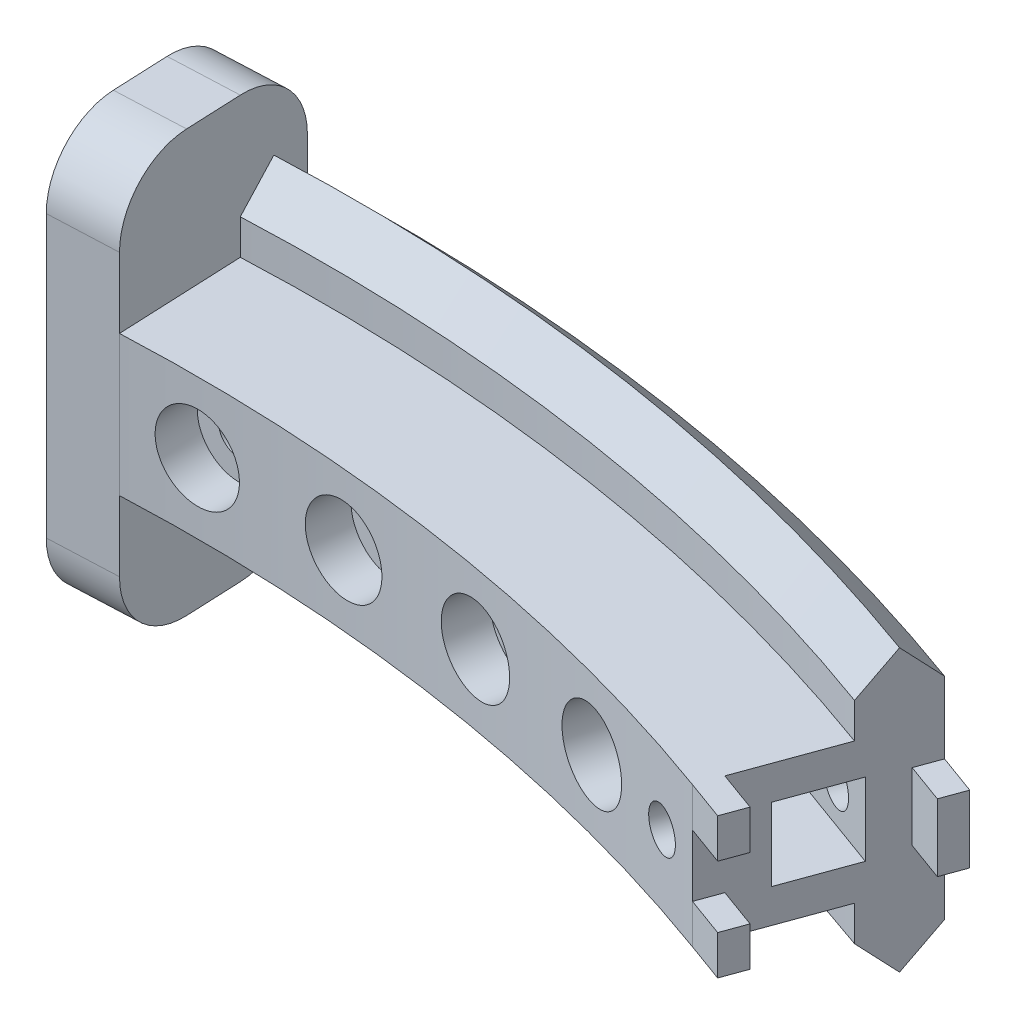
from build123d import *

# Parameters (mm, degrees)
REVOLVE_1_ANGLE          = 40
SKETCH_3_W               = 5.2
SKETCH_3_H               = 5.2
CUT_EXTRUDE_1_DEPTH      = 7
CUT_EXTRUDE_2_DEPTH      = 94.967026614
CUT_EXTRUDE_2_DEPTH_BACK = 94.967026614
SKETCH_5_R               = 1.5
CUT_EXTRUDE_START        = -2
SKETCH_6_R               = 3
CUT_EXTRUDE_3_DEPTH      = 93.938324905
SKETCH_12_R              = 1.5
CUT_EXTRUDE_5_DEPTH      = 54.141615619
CUT_EXTRUDE_6_DEPTH      = 5
SKETCH_14_W              = 3
SKETCH_14_H              = 3
PATTERN_CIRCULAR_1_COUNT = 4
PATTERN_CIRCULAR_1_ANGLE = 15
F_1_THE_OTHER_WAY_COUNT  = 4
F_1_THE_OTHER_WAY_ANGLE  = 15
SKETCH_9_W               = 1.8
SKETCH_9_H               = 4.8
SKETCH_9_H_2             = 2.8
EXTRUDE_2_DEPTH          = 3
SKETCH_10_W              = 52.448370613
SKETCH_10_H              = 39.953744926
CUT_EXTRUDE_4_DEPTH      = 149.179341739
SKETCH_11_W              = 14
SKETCH_11_H              = 30
EXTRUDE_3_DEPTH          = 5
FILLET_1_R               = 5


# Read off the part's stored shape, not the designer's step: 旋转1
with BuildPart() as part:
    # 旋转1 outline → 旋转1 (revolve)
    with BuildSketch(Plane(origin=(0, 0, 0), x_dir=(0.3420201433256701, 0, -0.9396926207859079), z_dir=(0.9396926207859079, 0, 0.3420201433256701))):
        Polygon((134, 5), (125, 5), (125, -5), (134, -5), (134, -7.5), (136.5, -10), (139, -7.5), (139, 7.5), (136.5, 10), (134, 7.5), align=None)
    revolve(axis=Axis((0, 0, 0), (0, 1, 0)), revolution_arc=REVOLVE_1_ANGLE)

    # 草图3 → 切除-拉伸1 (cut)
    with BuildSketch(Plane(origin=(0, 0, 0), x_dir=(0.34202014332566943, 0, -0.9396926207859081), z_dir=(0.9396926207859081, 0, 0.34202014332566943))):
        with Locations((132, 0)):
            Rectangle(SKETCH_3_W, SKETCH_3_H)
    extrude(amount=-CUT_EXTRUDE_1_DEPTH, mode=Mode.SUBTRACT)

    # 草图5 → 切除-拉伸2 (cut, two sides: drawn at the far end of the back side and taken through both)
    with BuildSketch(Plane(origin=(44.257406546, 0, -121.59622513), x_dir=(-0.9396926207859081, 0, -0.3420201433256695), z_dir=(0.3420201433256695, 0, -0.9396926207859081)).offset(-CUT_EXTRUDE_2_DEPTH_BACK)):
        with Locations((3.5, 0)):
            Circle(SKETCH_5_R)
    extrude(amount=CUT_EXTRUDE_2_DEPTH + CUT_EXTRUDE_2_DEPTH_BACK, mode=Mode.SUBTRACT)

    # 草图6 → 切除-拉伸3 (cut, through all)
    with BuildSketch(Plane(origin=(46.035911292, 0, -126.482626758), x_dir=(0.9396926207859081, 0, 0.3420201433256695), z_dir=(-0.3420201433256695, 0, 0.9396926207859081)).offset(CUT_EXTRUDE_START)):
        with Locations((-3.5, 0)):
            Circle(SKETCH_6_R)
    extrude(amount=-CUT_EXTRUDE_3_DEPTH, mode=Mode.SUBTRACT)

    # 草图12 → 切除-拉伸5 (cut, through all)
    with BuildSketch(Plane(origin=(0, 0, -139), x_dir=(-1, 0, 0), z_dir=(0, 0, -1))):
        Circle(SKETCH_12_R)
    cut_extrude_5 = extrude(amount=-CUT_EXTRUDE_5_DEPTH, mode=Mode.SUBTRACT)

    # 草图13 → 切除-拉伸6 (cut)
    with BuildSketch(Plane(origin=(0, 0, -139), x_dir=(-1, 0, 0), z_dir=(0, 0, -1))):
        Polygon((0, -3.175426481), (2.75, -1.58771324), (2.75, 1.58771324), (0, 3.175426481), (-2.75, 1.58771324), (-2.75, -1.58771324), align=None)
    cut_extrude_6 = extrude(amount=-CUT_EXTRUDE_6_DEPTH, mode=Mode.SUBTRACT)

    # 草图14 → 切除-旋转1 (revolve, cut)
    with BuildSketch(Plane(origin=(0, 0, 0), x_dir=(1, 0, 0), z_dir=(0, 1, 0)), mode=Mode.PRIVATE) as cut_revolve_1_sk:
        with Locations((1.5, 126.463994814)):
            Rectangle(SKETCH_14_W, SKETCH_14_H)
    cut_revolve_1 = revolve(cut_revolve_1_sk.sketch.rotate(Axis((0, 0, 1000), (0, 0, -1)), 180), axis=Axis((0, 0, 1000), (0, 0, -1)), mode=Mode.SUBTRACT)

    # 阵列(圆周)1: 切除-拉伸5, 切除-拉伸6, 切除-旋转1 ×4 about axis
    pattern_circular_1_axis = Axis((0, 0, 0), (0, 1, 0))
    add([cut_extrude_5.rotate(pattern_circular_1_axis, i * PATTERN_CIRCULAR_1_ANGLE / (PATTERN_CIRCULAR_1_COUNT - 1)) for i in range(1, PATTERN_CIRCULAR_1_COUNT)], mode=Mode.SUBTRACT)
    add([cut_extrude_6.rotate(pattern_circular_1_axis, i * PATTERN_CIRCULAR_1_ANGLE / (PATTERN_CIRCULAR_1_COUNT - 1)) for i in range(1, PATTERN_CIRCULAR_1_COUNT)], mode=Mode.SUBTRACT)
    add([cut_revolve_1.rotate(pattern_circular_1_axis, i * PATTERN_CIRCULAR_1_ANGLE / (PATTERN_CIRCULAR_1_COUNT - 1)) for i in range(1, PATTERN_CIRCULAR_1_COUNT)], mode=Mode.SUBTRACT)

    # 1 the other way: 切除-拉伸5, 切除-拉伸6, 切除-旋转1 ×4 about axis
    f_1_the_other_way_axis = Axis((0, 0, 0), (0, -1, 0))
    add([cut_extrude_5.rotate(f_1_the_other_way_axis, i * F_1_THE_OTHER_WAY_ANGLE / (F_1_THE_OTHER_WAY_COUNT - 1)) for i in range(1, F_1_THE_OTHER_WAY_COUNT)], mode=Mode.SUBTRACT)
    add([cut_extrude_6.rotate(f_1_the_other_way_axis, i * F_1_THE_OTHER_WAY_ANGLE / (F_1_THE_OTHER_WAY_COUNT - 1)) for i in range(1, F_1_THE_OTHER_WAY_COUNT)], mode=Mode.SUBTRACT)
    add([cut_revolve_1.rotate(f_1_the_other_way_axis, i * F_1_THE_OTHER_WAY_ANGLE / (F_1_THE_OTHER_WAY_COUNT - 1)) for i in range(1, F_1_THE_OTHER_WAY_COUNT)], mode=Mode.SUBTRACT)

    # 草图9 → 凸台-拉伸2 (add)
    with BuildSketch(Plane(origin=(0, 0, 0), x_dir=(0.34202014332566943, 0, -0.9396926207859082), z_dir=(0.9396926207859082, 0, 0.34202014332566943))):
        with Locations((138.1, 0)):
            Rectangle(SKETCH_9_W, SKETCH_9_H)
        with Locations((125.9, 3.6)):
            Rectangle(SKETCH_9_W, SKETCH_9_H_2)
        with Locations((125.9, -3.6)):
            Rectangle(SKETCH_9_W, SKETCH_9_H_2)
    extrude(amount=EXTRUDE_2_DEPTH)

    # 草图10 → 切除-拉伸4 (cut, through all)
    with BuildSketch(Plane(origin=(0, 0, 0), x_dir=(0, -1, 0), z_dir=(0.9990482215818578, 0, -0.04361938736533606))):
        with Locations((1.816079314, 125.001454628)):
            Rectangle(SKETCH_10_W, SKETCH_10_H)
    extrude(amount=-CUT_EXTRUDE_4_DEPTH, mode=Mode.SUBTRACT)

    # 草图11 → 凸台-拉伸3 (add)
    with BuildSketch(Plane(origin=(0, 0, 0), x_dir=(0.043619387365336076, 0, 0.9990482215818578), z_dir=(-0.9990482215818577, 0, 0.04361938736533607))):
        with Locations((-132, 0)):
            Rectangle(SKETCH_11_W, SKETCH_11_H)
    extrude(amount=EXTRUDE_3_DEPTH)

    # 圆角1
    fillet_1_edges = [part.edges().sort_by_distance(p)[0] for p in [
        (-8.560715398, 15, -138.758654331),
        (-8.560715398, -15, -138.758654331),
        (-7.950043975, -15, -124.771979229),
        (-7.950043975, 15, -124.771979229),
    ]]
    fillet(fillet_1_edges, radius=FILLET_1_R)


solid = part.part
